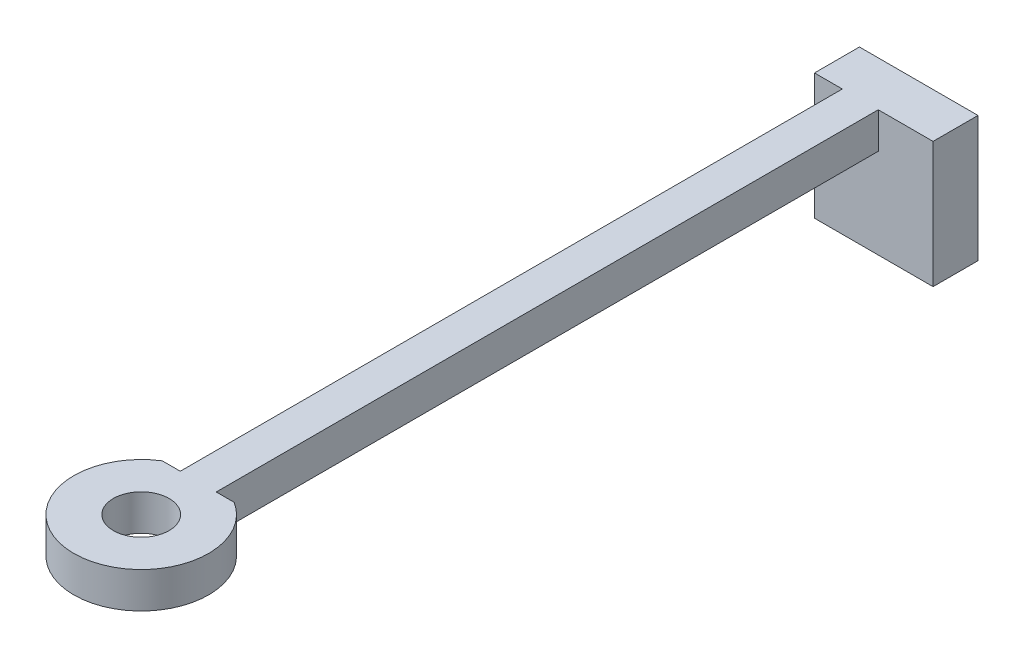
from build123d import *

# Parameters (mm, degrees)
SKETCH1_W                       = 8
SKETCH1_H                       = 90
SKETCH1_R                       = 3.1
BOSS_EXTRUDE1_DEPTH             = 4
FILLET1_R                       = 4
BOSS_EXTRUDE2_START             = -4
SKETCH2_R                       = 7.5
SKETCH2_R_2                     = 3.1
BOSS_EXTRUDE2_DEPTH             = 4
SKETCH3_W                       = 2
SKETCH3_H                       = 78.65571123
CUT_EXTRUDE2_DEPTH              = 49.254533466
SKETCH4_W                       = 1
SKETCH4_H                       = 78.65571123
SKETCH5_W                       = 13.19082965
SKETCH5_H                       = 5
BOSS_EXTRUDE5_DEPTH             = 10
BOSS_EXTRUDE5_DIRECTION_2_REACH = 50.255


with BuildPart() as part:
    # Sketch1 → Boss-Extrude1 (new body)
    with BuildSketch(Plane(origin=(0, 0, 0), x_dir=(1, 0, 0), z_dir=(0, 1, 0))):
        Rectangle(SKETCH1_W, SKETCH1_H)
        with Locations(Location((0, -40, 0), (0, 0, 270))):
            Circle(SKETCH1_R, mode=Mode.SUBTRACT)
    extrude(amount=BOSS_EXTRUDE1_DEPTH)

    # Fillet1
    fillet1_edges = [part.edges().sort_by_distance(p)[0] for p in [
        (-4, 2, 45),
        (4, 2, 45),
    ]]
    fillet(fillet1_edges, radius=FILLET1_R - 0.0001)  # a hair under: the kernel refuses the full size

    # Sketch2 → Boss-Extrude2 (add)
    with BuildSketch(Plane(origin=(0, 4, 0), x_dir=(1, 0, 0), z_dir=(0, 1, 0)).offset(BOSS_EXTRUDE2_START)):
        with Locations((0, -40)):
            Circle(SKETCH2_R)
        with Locations(Location((0, -40, 0), (0, 0, 270))):
            Circle(SKETCH2_R_2, mode=Mode.SUBTRACT)
    extrude(amount=BOSS_EXTRUDE2_DEPTH)

    # Sketch3 → Cut-Extrude2 (cut, through all)
    with BuildSketch(Plane(origin=(0, 4, 0), x_dir=(1, 0, 0), z_dir=(0, 1, 0))):
        with Locations((3, 5.672144385)):
            Rectangle(SKETCH3_W, SKETCH3_H)
        with Locations((-3, 5.672144385)):
            Rectangle(SKETCH3_W, SKETCH3_H)
    extrude(amount=-CUT_EXTRUDE2_DEPTH, mode=Mode.SUBTRACT)

    # Sketch4 → Revolve1 (revolve)
    with BuildSketch(Plane.XZ):
        with Locations((-0.5, -5.672144385)):
            Rectangle(SKETCH4_W, SKETCH4_H)
    revolve(axis=Axis((0, 0, 40), (0, 0, -1)))

    # Sketch5 → Boss-Extrude5 (add)
    with BuildSketch(Plane.XZ):
        with Locations((1.5, -42.5)):
            Rectangle(SKETCH5_W, SKETCH5_H)
    extrude(amount=BOSS_EXTRUDE5_DEPTH)

    # Boss-Extrude5 direction 2: up to this face of the body (flat: up to its plane)
    boss_extrude5_direction_2_end = Plane(part.part.faces().sort_by_distance((0, 4, 8.504231921))[0])
    # Sketch5 → Boss-Extrude5 direction 2 (add, up to the picked face)
    with BuildSketch(Plane.XZ, mode=Mode.PRIVATE) as boss_extrude5_direction_2_sk1:
        with Locations((1.5, -42.5)):
            Rectangle(SKETCH5_W, SKETCH5_H)
    boss_extrude5_direction_2_tool1 = split(extrude(boss_extrude5_direction_2_sk1.sketch, amount=-BOSS_EXTRUDE5_DIRECTION_2_REACH, mode=Mode.PRIVATE), bisect_by=boss_extrude5_direction_2_end, keep=Keep.BOTH, mode=Mode.PRIVATE)
    add(boss_extrude5_direction_2_tool1.solids().sort_by(Axis((1.5, 0, -42.5), (0, 1, 0)))[0])


solid = part.part
